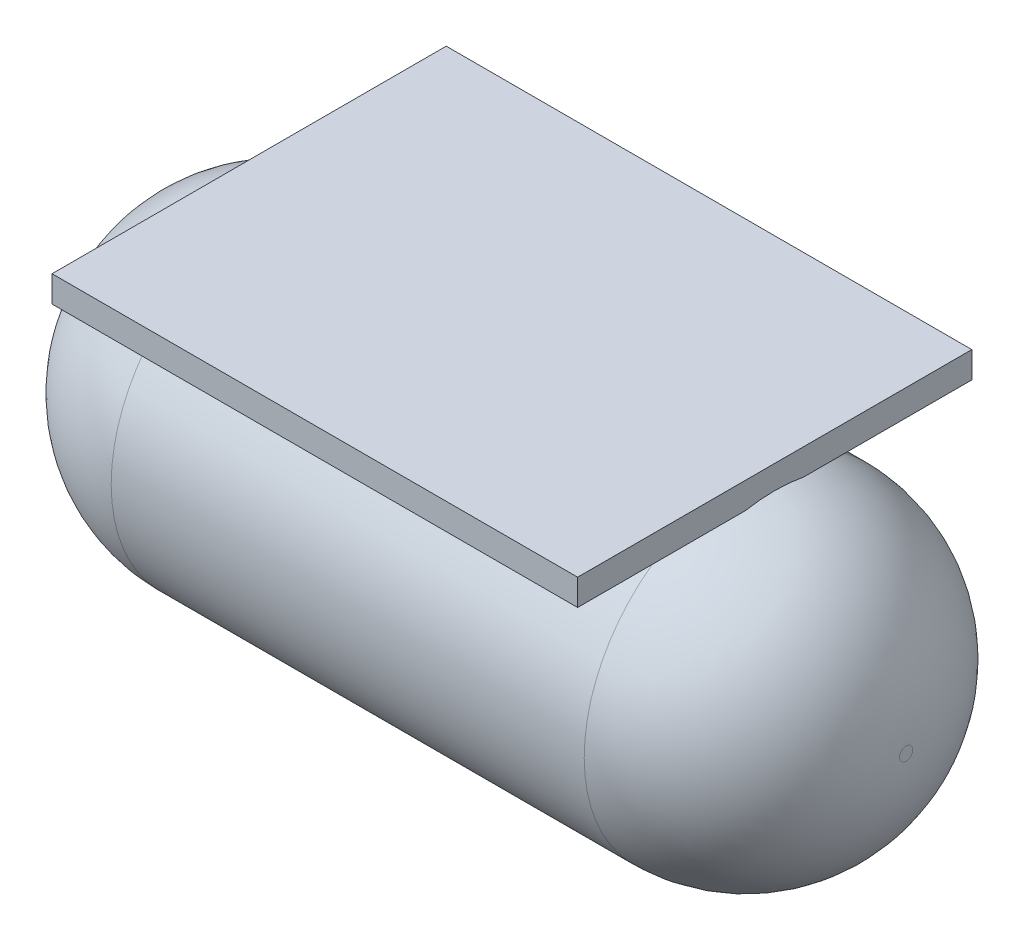
from build123d import *

# Parameters (mm, degrees)
SKETCH1_W           = 10.16
SKETCH1_H           = 7.62
BOSS_EXTRUDE1_DEPTH = 0.508
SKETCH2_R           = 3.175
BOSS_EXTRUDE2_DEPTH = 15.24
FILLET1_R           = 3.048
FILLET2_R           = 3.048


with BuildPart() as part:
    # Sketch1 → Boss-Extrude1 (new body)
    with BuildSketch(Plane(origin=(0, 0, 0), x_dir=(1, 0, 0), z_dir=(0, 1, 0))):
        with Locations((5.08, 3.81)):
            Rectangle(SKETCH1_W, SKETCH1_H)
    extrude(amount=BOSS_EXTRUDE1_DEPTH)

    # Sketch2 → Boss-Extrude2 (add)
    with BuildSketch(Plane(origin=(12.7, 0, 0), x_dir=(0, 0, -1), z_dir=(1, 0, 0))):
        with Locations((3.81, -3.080568226)):
            Circle(SKETCH2_R)
    extrude(amount=-BOSS_EXTRUDE2_DEPTH)

    # Fillet1
    # the kernel refuses this fillet: 3.048 mm, written as the material it takes off along each edge
    with BuildSketch(Plane(origin=(-2.54, -3.080568226, -3.81), x_dir=(0, 0, -1), z_dir=(0, -1, 0))) as fillet1_piece_1_section:
        with BuildLine():
            CenterArc((3.175 - FILLET1_R, FILLET1_R), FILLET1_R, 270, 90)
            Line((3.175 - FILLET1_R, 0), (3.175, 0))
            Line((3.175, 0), (3.175, FILLET1_R))
        make_face()
    fillet1_piece_1 = revolve(axis=Axis((-2.54, -3.080568226, -3.81), (1, 0, 0)), mode=Mode.PRIVATE)
    fillet1_piece_1 = split(fillet1_piece_1, bisect_by=Plane(origin=(0, -1.050120042, -6.248507941), z_dir=(1, 0, 0)), keep=Keep.TOP, mode=Mode.PRIVATE)
    fillet1_piece_1 = split(fillet1_piece_1, bisect_by=Plane(origin=(0.252364317, 0, -6.248507941), z_dir=(0, -1, 0)), keep=Keep.TOP, mode=Mode.PRIVATE)
    add(fillet1_piece_1, mode=Mode.SUBTRACT)
    with BuildSketch(Plane(origin=(-2.54, -3.080568226, -3.81), x_dir=(0, 0, -1), z_dir=(0, -1, 0))) as fillet1_piece_2_section:
        with BuildLine():
            CenterArc((3.175 - FILLET1_R, FILLET1_R), FILLET1_R, 270, 90)
            Line((3.175 - FILLET1_R, 0), (3.175, 0))
            Line((3.175, 0), (3.175, FILLET1_R))
        make_face()
    fillet1_piece_2 = revolve(axis=Axis((-2.54, -3.080568226, -3.81), (1, 0, 0)), mode=Mode.PRIVATE)
    fillet1_piece_2 = split(fillet1_piece_2, bisect_by=Plane(origin=(0, -3.080568226, -1.694272015), z_dir=(-1, 0, 0)), keep=Keep.TOP, mode=Mode.PRIVATE)
    fillet1_piece_2 = split(fillet1_piece_2, bisect_by=Plane(origin=(-1.845094679, 0, -1.694272015), z_dir=(0, -1, 0)), keep=Keep.TOP, mode=Mode.PRIVATE)
    add(fillet1_piece_2, mode=Mode.SUBTRACT)
    with BuildSketch(Plane(origin=(-2.54, -3.080568226, -3.81), x_dir=(0, 0, -1), z_dir=(0, -1, 0))) as fillet1_piece_3_section:
        with BuildLine():
            CenterArc((3.175 - FILLET1_R, FILLET1_R), FILLET1_R, 270, 90)
            Line((3.175 - FILLET1_R, 0), (3.175, 0))
            Line((3.175, 0), (3.175, FILLET1_R))
        make_face()
    fillet1_piece_3 = revolve(axis=Axis((-2.54, -3.080568226, -3.81), (1, 0, 0)), mode=Mode.PRIVATE)
    fillet1_piece_3 = split(fillet1_piece_3, bisect_by=Plane(origin=(0, 0.062655826, -3.81), z_dir=(-1, 0, 0)), keep=Keep.TOP, mode=Mode.PRIVATE)
    fillet1_piece_3 = split(fillet1_piece_3, bisect_by=Plane(origin=(-1.310113103, 0, -3.81), z_dir=(0, 1, 0)), keep=Keep.TOP, mode=Mode.PRIVATE)
    add(fillet1_piece_3, mode=Mode.SUBTRACT)

    # Fillet2
    # the kernel refuses this fillet: 3.048 mm, written as the material it takes off along each edge
    with BuildSketch(Plane(origin=(12.7, -3.080568226, -3.81), x_dir=(0, 0, -1), z_dir=(0, -1, 0))) as fillet2_piece_1_section:
        with BuildLine():
            CenterArc((3.175 - FILLET2_R, -FILLET2_R), FILLET2_R, 0, 90)
            Line((3.175 - FILLET2_R, 0), (3.175, 0))
            Line((3.175, 0), (3.175, -FILLET2_R))
        make_face()
    fillet2_piece_1 = revolve(axis=Axis((12.7, -3.080568226, -3.81), (1, 0, 0)), mode=Mode.PRIVATE)
    fillet2_piece_1 = split(fillet2_piece_1, bisect_by=Plane(origin=(9.907635683, 0, -6.248507942), z_dir=(0, -1, 0)), keep=Keep.TOP, mode=Mode.PRIVATE)
    fillet2_piece_1 = split(fillet2_piece_1, bisect_by=Plane(origin=(10.16, -1.050120042, -6.248507942), z_dir=(-1, 0, 0)), keep=Keep.TOP, mode=Mode.PRIVATE)
    add(fillet2_piece_1, mode=Mode.SUBTRACT)
    with BuildSketch(Plane(origin=(12.7, -3.080568226, -3.81), x_dir=(0, 0, -1), z_dir=(0, -1, 0))) as fillet2_piece_2_section:
        with BuildLine():
            CenterArc((3.175 - FILLET2_R, -FILLET2_R), FILLET2_R, 0, 90)
            Line((3.175 - FILLET2_R, 0), (3.175, 0))
            Line((3.175, 0), (3.175, -FILLET2_R))
        make_face()
    fillet2_piece_2 = revolve(axis=Axis((12.7, -3.080568226, -3.81), (1, 0, 0)), mode=Mode.PRIVATE)
    fillet2_piece_2 = split(fillet2_piece_2, bisect_by=Plane(origin=(12.005094679, 0, -1.694272014), z_dir=(0, -1, 0)), keep=Keep.TOP, mode=Mode.PRIVATE)
    fillet2_piece_2 = split(fillet2_piece_2, bisect_by=Plane(origin=(10.16, -3.080568226, -1.694272014), z_dir=(1, 0, 0)), keep=Keep.TOP, mode=Mode.PRIVATE)
    add(fillet2_piece_2, mode=Mode.SUBTRACT)
    with BuildSketch(Plane(origin=(12.7, -3.080568226, -3.81), x_dir=(0, 0, -1), z_dir=(0, -1, 0))) as fillet2_piece_3_section:
        with BuildLine():
            CenterArc((3.175 - FILLET2_R, -FILLET2_R), FILLET2_R, 0, 90)
            Line((3.175 - FILLET2_R, 0), (3.175, 0))
            Line((3.175, 0), (3.175, -FILLET2_R))
        make_face()
    fillet2_piece_3 = revolve(axis=Axis((12.7, -3.080568226, -3.81), (1, 0, 0)), mode=Mode.PRIVATE)
    fillet2_piece_3 = split(fillet2_piece_3, bisect_by=Plane(origin=(11.470113103, 0, -3.81), z_dir=(0, 1, 0)), keep=Keep.TOP, mode=Mode.PRIVATE)
    fillet2_piece_3 = split(fillet2_piece_3, bisect_by=Plane(origin=(10.16, 0.062655826, -3.81), z_dir=(1, 0, 0)), keep=Keep.TOP, mode=Mode.PRIVATE)
    add(fillet2_piece_3, mode=Mode.SUBTRACT)


solid = part.part
